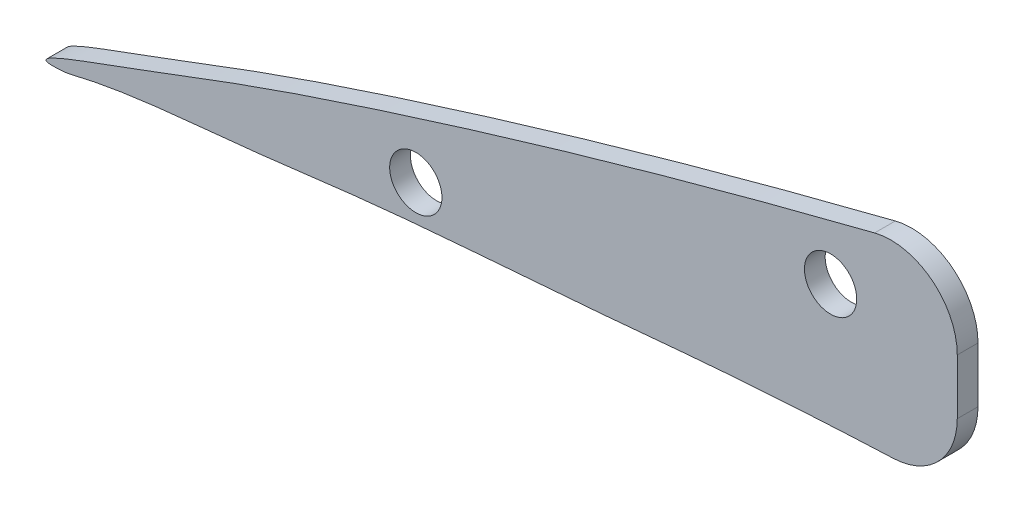
from build123d import *

# Parameters (mm, degrees)
BOSS_EXTRUDE1_DEPTH       = 226.06
CUT_EXTRUDE1_DEPTH        = 248.603669875
CUT_EXTRUDE1_DEPTH_BACK   = 248.603669875
FILLET1_R                 = 5.08
SHELL1_START              = 31.75
SHELL1_DEPTH              = 162.56
SHELL1_START_2            = 3.175
SHELL1_2_DEPTH            = 219.71
SKETCH3_R                 = 2.032
CUT_EXTRUDE2_DEPTH        = 246.233624371
BOSS_EXTRUDE2_START       = -4.025198094
BOSS_EXTRUDE2_OUTLINE_R   = 1.5875
BOSS_EXTRUDE2_DEPTH       = 5.811624811
BOSS_EXTRUDE2_START_2     = -8.955775483
BOSS_EXTRUDE2_2_OUTLINE_R = 1.5875
BOSS_EXTRUDE2_2_DEPTH     = 4.930577389
CUT_EXTRUDE3_DEPTH        = 246.233624371
CUT_EXTRUDE3_DEPTH_BACK   = 246.233624371
SKETCH5_W                 = 235.931423423
SKETCH5_H                 = 77.627996968
SKETCH6_R                 = 2
CUT_EXTRUDE4_DEPTH        = 74.976362333


# Read off the part's stored shape, not the designer's step: Shell1, Boss-Extrude2
with BuildPart() as part:
    # Sketch1 → Boss-Extrude1 (new body)
    with BuildSketch(Plane.XY):
        with BuildLine():
            Line((99.32639085, 18.404394796), (99.32639085, -2.986448862))
            add(Edge.make_bspline(
                [(5.047603806, -9.653713384), (9.482649657, -8.546128483), (16.988483729, -8.076906091), (30.336595099, -6.254410192), (41.946659702, -5.566037344), (65.865842143, -3.231342143), (83.974811725, -3.089086557), (99.32639085, -2.986448862)],
                knots=[0, 0, 0, 0, 0.144322392, 0.237947652, 0.42712275, 0.512831912, 1, 1, 1, 1], degree=3))
            add(Edge.make_bspline(
                [(5.047603806, -9.653713384), (1.304537033, -10.042523479), (11.503328192, -6.353494655), (19.723627138, -3.092777487), (52.915151131, 7.645918304), (77.889766355, 13.460013374), (99.32639085, 18.404394796)],
                knots=[0, 0, 0, 0, 0.059914523, 0.175786391, 0.369274689, 1, 1, 1, 1], degree=3))
        make_face()
    extrude(amount=BOSS_EXTRUDE1_DEPTH)

    # Sketch2 → Cut-Extrude1 (cut, two sides: drawn at the far end of the back side and taken through both)
    with BuildSketch(Plane(origin=(0, 0, 0), x_dir=(1, 0, 0), z_dir=(0, 1, 0)).offset(-CUT_EXTRUDE1_DEPTH_BACK)):
        Polygon((169.681502528, 0), (169.681502528, -226.06), (73.16439085, -226.06), (73.16439085, -197.485), (93.73839085, -197.485), (93.73839085, -28.575), (73.16439085, -28.575), (73.16439085, 0), align=None)
    extrude(amount=CUT_EXTRUDE1_DEPTH + CUT_EXTRUDE1_DEPTH_BACK, mode=Mode.SUBTRACT)

    # Fillet1
    fillet1_edges = [part.edges().sort_by_distance(p)[0] for p in [
        (73.16439085, -3.388889971, 14.2875),
        (73.16439085, 12.236004014, 14.2875),
        (93.73839085, -3.026654485, 113.03),
        (93.73839085, 17.113551214, 113.03),
        (73.16439085, -3.388889971, 211.7725),
        (73.16439085, 12.236004014, 211.7725),
    ]]
    fillet(fillet1_edges, radius=FILLET1_R)

    # Shell1 outline → Shell1 (cut)
    with BuildSketch(Plane.XY.offset(SHELL1_START)):
        with BuildLine():
            ThreePointArc((90.56339085, 10.716231692), (89.84210345, 12.208829924), (88.224441264, 12.571147528))
            add(Edge.make_bspline(
                [(88.224441264, 12.571147528), (87.199954726, 12.331473265), (86.178161178, 12.091844736), (85.158893539, 11.852170354), (84.141984638, 11.612358579), (83.127267128, 11.372317854), (82.11457348, 11.131956606), (81.103735991, 10.891183246), (80.094586779, 10.649906167), (79.086957782, 10.408033746), (78.080680762, 10.165474344), (77.075587303, 9.922136302), (75.365261077, 9.50615692), (74.659515429, 9.333955274), (73.95421322, 9.161291111), (73.24929575, 8.988132524), (72.544704275, 8.814447596), (71.84038, 8.640204402), (71.136264087, 8.465371009), (70.432297655, 8.289915474), (69.728421779, 8.113805846), (69.024577498, 7.937010164), (68.320705808, 7.759496459), (67.616747671, 7.581232754)],
                knots=[0.118068853, 0.118068853, 0.118068853, 0.118068853, 0.118068853, 0.118068853, 0.118068853, 0.118068853, 0.118068853, 0.118068853, 0.118068853, 0.118068853, 0.118068853, 0.242924315, 0.242924315, 0.242924315, 0.242924315, 0.242924315, 0.242924315, 0.242924315, 0.242924315, 0.242924315, 0.242924315, 0.242924315, 0.330745026, 0.330745026, 0.330745026, 0.330745026, 0.330745026, 0.330745026, 0.330745026, 0.330745026, 0.330745026, 0.330745026, 0.330745026, 0.330745026, 0.330745026], degree=12))
            ThreePointArc((67.616747671, 7.581232754), (69.254468773, 7.237834237), (69.98939085, 5.734523672))
            Line((69.98939085, 5.734523672), (69.98939085, 1.506513014))
            ThreePointArc((69.98939085, 1.506513014), (69.459523341, 0.188167221), (68.164681525, -0.396794214))
            add(Edge.make_bspline(
                [(68.164681525, -0.396794214), (68.694992172, -0.374423154), (69.225275053, -0.352727917), (69.755528584, -0.331695291), (70.285751179, -0.311312074), (70.815941255, -0.291565067), (71.346097229, -0.272441078), (71.876217523, -0.25392692), (72.406300557, -0.236009412), (72.936344753, -0.218675382), (73.466348538, -0.201911658), (73.996310335, -0.18570508), (74.526228574, -0.170042489), (75.056101682, -0.154910735), (76.522372139, -0.114466983), (77.45867021, -0.090254504), (78.394813662, -0.06758666), (79.330793845, -0.046390933), (80.266602102, -0.026594862), (81.202229769, -0.008126042), (82.137668173, 0.009087874), (83.072908636, 0.025119175), (84.007942471, 0.040040096), (84.942760983, 0.053922812), (85.87735547, 0.066839443), (86.811717225, 0.07886205), (87.74583753, 0.09006264), (88.679707661, 0.100513159)],
                knots=[0.67202474, 0.67202474, 0.67202474, 0.67202474, 0.67202474, 0.67202474, 0.67202474, 0.67202474, 0.67202474, 0.67202474, 0.67202474, 0.67202474, 0.67202474, 0.67202474, 0.67202474, 0.75, 0.75, 0.75, 0.75, 0.75, 0.75, 0.75, 0.75, 0.75, 0.75, 0.75, 0.75, 0.75, 0.887817721, 0.887817721, 0.887817721, 0.887817721, 0.887817721, 0.887817721, 0.887817721, 0.887817721, 0.887817721, 0.887817721, 0.887817721, 0.887817721, 0.887817721, 0.887817721, 0.887817721], degree=14))
            ThreePointArc((88.679707661, 0.100513159), (90.012944885, 0.665913267), (90.56339085, 2.0053939))
            Line((90.56339085, 2.0053939), (90.56339085, 10.716231692))
        make_face()
        with BuildLine():
            ThreePointArc((69.98939085, 5.734523672), (69.254468773, 7.237834237), (67.616747644, 7.581232862))
            add(Edge.make_bspline(
                [(67.616747644, 7.581232862), (65.399836461, 7.019843113), (63.182067917, 6.451015332), (60.961598132, 5.873750666), (58.736579605, 5.2870495), (56.505161763, 4.689911333), (54.265491496, 4.081334769), (52.015713682, 3.460317509), (49.753971716, 2.825856339), (47.478408044, 2.176947117), (45.187164685, 1.512584769), (42.878383765, 0.831763272), (40.358491497, 0.075974277), (40.166643435, 0.018354472), (39.974662823, -0.039384328), (39.782548624, -0.097242688), (39.590299803, -0.155221168), (39.397915321, -0.213320331), (39.205394144, -0.271540739), (39.012735233, -0.329882954), (38.819937552, -0.388347539), (38.627000064, -0.446935056), (38.433921733, -0.505646067), (38.047481311, -0.6233162), (37.854115889, -0.68227633), (37.660618706, -0.741357704), (37.46700324, -0.800556496), (37.273282999, -0.859868869), (37.079471514, -0.919290978), (36.885582349, -0.97881897), (36.69162909, -1.038448983), (36.497625354, -1.098177145), (36.303584785, -1.157999576), (36.109521054, -1.217912388), (35.527301471, -1.397910273), (35.139116839, -1.518254909), (34.751002758, -1.638914656), (34.363068079, -1.759858551), (33.975421705, -1.881055606), (33.588172595, -2.002474805), (33.20142976, -2.124085105), (32.815302268, -2.245855438), (32.429899238, -2.367754709), (32.045329846, -2.489751794), (31.66170332, -2.611815547), (31.123971117, -2.783433666), (30.968986334, -2.832958389), (30.814181899, -2.882486873), (30.659565113, -2.93201703), (30.505143284, -2.981546776), (30.350923715, -3.031074022), (30.196913716, -3.080596682), (30.043120596, -3.130112665), (29.889551668, -3.179619883), (29.736214245, -3.229116246), (29.583115647, -3.27859966), (29.430263192, -3.328068033)],
                knots=[0.330745026, 0.330745026, 0.330745026, 0.330745026, 0.330745026, 0.330745026, 0.330745026, 0.330745026, 0.330745026, 0.330745026, 0.330745026, 0.330745026, 0.330745026, 0.607310788, 0.607310788, 0.607310788, 0.607310788, 0.607310788, 0.607310788, 0.607310788, 0.607310788, 0.607310788, 0.607310788, 0.607310788, 0.630084943, 0.630084943, 0.630084943, 0.630084943, 0.630084943, 0.630084943, 0.630084943, 0.630084943, 0.630084943, 0.630084943, 0.630084943, 0.652859097, 0.652859097, 0.652859097, 0.652859097, 0.652859097, 0.652859097, 0.652859097, 0.652859097, 0.652859097, 0.652859097, 0.652859097, 0.698407406, 0.698407406, 0.698407406, 0.698407406, 0.698407406, 0.698407406, 0.698407406, 0.698407406, 0.698407406, 0.698407406, 0.698407406, 0.716880093, 0.716880093, 0.716880093, 0.716880093, 0.716880093, 0.716880093, 0.716880093, 0.716880093, 0.716880093, 0.716880093, 0.716880093, 0.716880093, 0.716880093], degree=12))
            add(Edge.make_bspline(
                [(29.430263192, -3.328068033), (30.192321788, -3.253103705), (30.953742852, -3.181055792), (31.714498333, -3.111652976), (32.474560286, -3.044625223), (33.233901052, -2.979703638), (33.992493217, -2.916620464), (34.750309569, -2.855109092), (35.507323058, -2.794904058), (36.26350675, -2.735741051), (37.018833789, -2.677356913), (37.77327735, -2.619489644), (38.526810601, -2.561878406), (39.27940666, -2.504263523), (40.241275886, -2.430197827), (40.451437795, -2.413988578), (40.661523692, -2.397753121), (40.871532992, -2.381485838), (41.081465111, -2.36518111), (41.291319462, -2.34883332), (41.501095461, -2.332436848), (41.710792523, -2.315986075), (41.920410064, -2.299475384), (42.129947497, -2.282899155), (42.339404239, -2.266251771), (42.548779704, -2.249527611), (42.758073307, -2.232721059), (43.071890042, -2.207379213), (43.176475009, -2.198909942), (43.281039293, -2.190417989), (43.38558282, -2.181902656), (43.490105518, -2.173363251), (43.594607315, -2.164799076), (43.699088138, -2.156209439), (43.803547915, -2.147593642), (43.907986571, -2.138950992), (44.012404037, -2.130280793), (44.116800238, -2.12158235), (44.221175102, -2.112854969), (44.325528557, -2.104097954), (44.482026516, -2.090916937), (44.534185416, -2.08651578), (44.586353102, -2.082106088), (44.638462372, -2.077692142), (44.690677468, -2.073262507), (44.74276457, -2.068834253), (44.79486261, -2.064396055), (44.84709011, -2.05993977), (44.899190406, -2.055485443), (44.951182515, -2.051030032), (45.003429676, -2.046545196), (45.055514905, -2.042065555), (45.107662823, -2.037572174), (45.211955574, -2.028569312), (45.264108442, -2.024059127), (45.316267814, -2.019540326), (45.368433702, -2.015013048), (45.42060612, -2.010477431), (45.472785076, -2.005933613), (45.524970589, -2.001381732), (45.577162664, -1.996821927), (45.629361319, -1.992254336), (45.681566563, -1.987679097), (45.73377841, -1.983096348), (45.785996871, -1.978506228), (45.838221958, -1.973908876), (46.3083075, -1.93246885), (46.726586222, -1.895179261), (47.145296128, -1.857506655), (47.564443519, -1.819522312), (47.98403472, -1.781297798), (48.404076086, -1.742904961), (48.824573993, -1.704415937), (49.24553485, -1.665903148), (49.66696508, -1.627439299), (50.088871145, -1.589097383), (50.511259522, -1.550950675), (50.934136722, -1.513072738), (51.357509275, -1.47553742), (51.834368049, -1.433779033), (51.8873602, -1.429145723), (51.940360205, -1.424519069), (51.993368079, -1.419899217), (52.046383832, -1.415286311), (52.099407479, -1.410680497), (52.152439032, -1.40608192), (52.205478504, -1.401490725), (52.258525908, -1.396907058), (52.311581256, -1.392331062), (52.364644562, -1.387762884), (52.417715838, -1.38320267), (52.470795096, -1.378650563), (52.576969604, -1.369562855), (52.630062039, -1.365027462), (52.683179331, -1.360499209), (52.736263003, -1.355982684), (52.78940087, -1.351471194), (52.842545574, -1.346968801), (52.895651993, -1.342479031), (52.948780943, -1.337996995), (53.001972248, -1.333519945), (53.055147327, -1.329054684), (53.108262643, -1.324604451), (53.161436979, -1.320159017), (53.214588182, -1.31572572), (53.37405314, -1.302454763), (53.48036356, -1.293647424), (53.586674415, -1.284879943), (53.692985692, -1.276152212), (53.799297377, -1.267464124), (53.905609457, -1.258815573), (54.011921919, -1.25020645), (54.118234749, -1.241636649), (54.224547934, -1.233106063), (54.330861461, -1.224614583), (54.437175316, -1.216162103), (54.543489487, -1.207748516), (54.649803959, -1.199373714), (54.96874824, -1.174365343), (55.181378913, -1.157847807), (55.394010633, -1.141484125), (55.606643294, -1.125273441), (55.819276791, -1.109214898), (56.031911017, -1.093307639), (56.244545869, -1.077550807), (56.457181238, -1.061943545), (56.669817021, -1.046484998), (56.882453112, -1.031174307), (57.095089404, -1.016010616), (57.307725793, -1.000993068), (57.520362172, -0.986120806), (58.158270965, -0.941937311), (58.583543022, -0.913059346), (59.008813776, -0.884752245), (59.434082397, -0.857009171), (59.859348051, -0.829823289), (60.284609909, -0.803187765), (60.709867137, -0.777095761), (61.135118907, -0.751540443), (61.560364383, -0.726514975), (61.985602738, -0.702012521), (62.410833137, -0.678026246), (62.83605475, -0.654549315), (63.261266746, -0.631574892), (64.006388166, -0.592183223), (64.32630213, -0.575550919), (64.646209835, -0.559196323), (64.96611093, -0.543116532), (65.286005067, -0.527308639), (65.605891895, -0.511769741), (65.925771064, -0.496496937), (66.245642227, -0.481487322), (66.565505034, -0.466737997), (66.885359135, -0.45224606), (67.205204184, -0.438008612), (67.52503983, -0.424022754), (67.844865727, -0.410285587), (68.164681525, -0.396794215)],
                knots=[0.263276283, 0.263276283, 0.263276283, 0.263276283, 0.263276283, 0.263276283, 0.263276283, 0.263276283, 0.263276283, 0.263276283, 0.263276283, 0.263276283, 0.263276283, 0.263276283, 0.263276283, 0.375, 0.375, 0.375, 0.375, 0.375, 0.375, 0.375, 0.375, 0.375, 0.375, 0.375, 0.375, 0.375, 0.40625, 0.40625, 0.40625, 0.40625, 0.40625, 0.40625, 0.40625, 0.40625, 0.40625, 0.40625, 0.40625, 0.40625, 0.40625, 0.421875, 0.421875, 0.421875, 0.421875, 0.421875, 0.421875, 0.421875, 0.421875, 0.421875, 0.421875, 0.421875, 0.421875, 0.421875, 0.4296875, 0.4296875, 0.4296875, 0.4296875, 0.4296875, 0.4296875, 0.4296875, 0.4296875, 0.4296875, 0.4296875, 0.4296875, 0.4296875, 0.4296875, 0.4375, 0.4375, 0.4375, 0.4375, 0.4375, 0.4375, 0.4375, 0.4375, 0.4375, 0.4375, 0.4375, 0.4375, 0.4375, 0.5, 0.5, 0.5, 0.5, 0.5, 0.5, 0.5, 0.5, 0.5, 0.5, 0.5, 0.5, 0.5, 0.5078125, 0.5078125, 0.5078125, 0.5078125, 0.5078125, 0.5078125, 0.5078125, 0.5078125, 0.5078125, 0.5078125, 0.5078125, 0.5078125, 0.5078125, 0.515625, 0.515625, 0.515625, 0.515625, 0.515625, 0.515625, 0.515625, 0.515625, 0.515625, 0.515625, 0.515625, 0.515625, 0.515625, 0.53125, 0.53125, 0.53125, 0.53125, 0.53125, 0.53125, 0.53125, 0.53125, 0.53125, 0.53125, 0.53125, 0.53125, 0.53125, 0.5625, 0.5625, 0.5625, 0.5625, 0.5625, 0.5625, 0.5625, 0.5625, 0.5625, 0.5625, 0.5625, 0.5625, 0.5625, 0.625, 0.625, 0.625, 0.625, 0.625, 0.625, 0.625, 0.625, 0.625, 0.625, 0.625, 0.625, 0.625, 0.67202474, 0.67202474, 0.67202474, 0.67202474, 0.67202474, 0.67202474, 0.67202474, 0.67202474, 0.67202474, 0.67202474, 0.67202474, 0.67202474, 0.67202474, 0.67202474, 0.67202474], degree=14))
            ThreePointArc((68.164681525, -0.396794215), (69.459523341, 0.188167221), (69.98939085, 1.506513014))
            Line((69.98939085, 1.506513014), (69.98939085, 5.734523672))
        make_face()
    extrude(amount=SHELL1_DEPTH, mode=Mode.SUBTRACT)

    # Shell1 2 outline → Shell1 2 (cut)
    with BuildSketch(Plane.XY.offset(SHELL1_START_2)):
        with BuildLine():
            ThreePointArc((69.98939085, 5.734523672), (69.254468773, 7.237834237), (67.616747644, 7.581232862))
            add(Edge.make_bspline(
                [(67.616747644, 7.581232862), (65.399836461, 7.019843113), (63.182067917, 6.451015332), (60.961598132, 5.873750666), (58.736579605, 5.2870495), (56.505161763, 4.689911333), (54.265491496, 4.081334769), (52.015713682, 3.460317509), (49.753971716, 2.825856339), (47.478408044, 2.176947117), (45.187164685, 1.512584769), (42.878383765, 0.831763272), (40.358491497, 0.075974277), (40.166643435, 0.018354472), (39.974662823, -0.039384328), (39.782548624, -0.097242688), (39.590299803, -0.155221168), (39.397915321, -0.213320331), (39.205394144, -0.271540739), (39.012735233, -0.329882954), (38.819937552, -0.388347539), (38.627000064, -0.446935056), (38.433921733, -0.505646067), (38.047481311, -0.6233162), (37.854115889, -0.68227633), (37.660618706, -0.741357704), (37.46700324, -0.800556496), (37.273282999, -0.859868869), (37.079471514, -0.919290978), (36.885582349, -0.97881897), (36.69162909, -1.038448983), (36.497625354, -1.098177145), (36.303584785, -1.157999576), (36.109521054, -1.217912388), (35.527301471, -1.397910273), (35.139116839, -1.518254909), (34.751002758, -1.638914656), (34.363068079, -1.759858551), (33.975421705, -1.881055606), (33.588172595, -2.002474805), (33.20142976, -2.124085105), (32.815302268, -2.245855438), (32.429899238, -2.367754709), (32.045329846, -2.489751794), (31.66170332, -2.611815547), (31.123971117, -2.783433666), (30.968986334, -2.832958389), (30.814181899, -2.882486873), (30.659565113, -2.93201703), (30.505143284, -2.981546776), (30.350923715, -3.031074022), (30.196913716, -3.080596682), (30.043120596, -3.130112665), (29.889551668, -3.179619883), (29.736214245, -3.229116246), (29.583115647, -3.27859966), (29.430263192, -3.328068033)],
                knots=[0.330745026, 0.330745026, 0.330745026, 0.330745026, 0.330745026, 0.330745026, 0.330745026, 0.330745026, 0.330745026, 0.330745026, 0.330745026, 0.330745026, 0.330745026, 0.607310788, 0.607310788, 0.607310788, 0.607310788, 0.607310788, 0.607310788, 0.607310788, 0.607310788, 0.607310788, 0.607310788, 0.607310788, 0.630084943, 0.630084943, 0.630084943, 0.630084943, 0.630084943, 0.630084943, 0.630084943, 0.630084943, 0.630084943, 0.630084943, 0.630084943, 0.652859097, 0.652859097, 0.652859097, 0.652859097, 0.652859097, 0.652859097, 0.652859097, 0.652859097, 0.652859097, 0.652859097, 0.652859097, 0.698407406, 0.698407406, 0.698407406, 0.698407406, 0.698407406, 0.698407406, 0.698407406, 0.698407406, 0.698407406, 0.698407406, 0.698407406, 0.716880093, 0.716880093, 0.716880093, 0.716880093, 0.716880093, 0.716880093, 0.716880093, 0.716880093, 0.716880093, 0.716880093, 0.716880093, 0.716880093, 0.716880093], degree=12))
            add(Edge.make_bspline(
                [(29.430263192, -3.328068033), (30.192321788, -3.253103705), (30.953742852, -3.181055792), (31.714498333, -3.111652976), (32.474560286, -3.044625223), (33.233901052, -2.979703638), (33.992493217, -2.916620464), (34.750309569, -2.855109092), (35.507323058, -2.794904058), (36.26350675, -2.735741051), (37.018833789, -2.677356913), (37.77327735, -2.619489644), (38.526810601, -2.561878406), (39.27940666, -2.504263523), (40.241275886, -2.430197827), (40.451437795, -2.413988578), (40.661523692, -2.397753121), (40.871532992, -2.381485838), (41.081465111, -2.36518111), (41.291319462, -2.34883332), (41.501095461, -2.332436848), (41.710792523, -2.315986075), (41.920410064, -2.299475384), (42.129947497, -2.282899155), (42.339404239, -2.266251771), (42.548779704, -2.249527611), (42.758073307, -2.232721059), (43.071890042, -2.207379213), (43.176475009, -2.198909942), (43.281039293, -2.190417989), (43.38558282, -2.181902656), (43.490105518, -2.173363251), (43.594607315, -2.164799076), (43.699088138, -2.156209439), (43.803547915, -2.147593642), (43.907986571, -2.138950992), (44.012404037, -2.130280793), (44.116800238, -2.12158235), (44.221175102, -2.112854969), (44.325528557, -2.104097954), (44.482026516, -2.090916937), (44.534185416, -2.08651578), (44.586353102, -2.082106088), (44.638462372, -2.077692142), (44.690677468, -2.073262507), (44.74276457, -2.068834253), (44.79486261, -2.064396055), (44.84709011, -2.05993977), (44.899190406, -2.055485443), (44.951182515, -2.051030032), (45.003429676, -2.046545196), (45.055514905, -2.042065555), (45.107662823, -2.037572174), (45.211955574, -2.028569312), (45.264108442, -2.024059127), (45.316267814, -2.019540326), (45.368433702, -2.015013048), (45.42060612, -2.010477431), (45.472785076, -2.005933613), (45.524970589, -2.001381732), (45.577162664, -1.996821927), (45.629361319, -1.992254336), (45.681566563, -1.987679097), (45.73377841, -1.983096348), (45.785996871, -1.978506228), (45.838221958, -1.973908876), (46.3083075, -1.93246885), (46.726586222, -1.895179261), (47.145296128, -1.857506655), (47.564443519, -1.819522312), (47.98403472, -1.781297798), (48.404076086, -1.742904961), (48.824573993, -1.704415937), (49.24553485, -1.665903148), (49.66696508, -1.627439299), (50.088871145, -1.589097383), (50.511259522, -1.550950675), (50.934136722, -1.513072738), (51.357509275, -1.47553742), (51.834368049, -1.433779033), (51.8873602, -1.429145723), (51.940360205, -1.424519069), (51.993368079, -1.419899217), (52.046383832, -1.415286311), (52.099407479, -1.410680497), (52.152439032, -1.40608192), (52.205478504, -1.401490725), (52.258525908, -1.396907058), (52.311581256, -1.392331062), (52.364644562, -1.387762884), (52.417715838, -1.38320267), (52.470795096, -1.378650563), (52.576969604, -1.369562855), (52.630062039, -1.365027462), (52.683179331, -1.360499209), (52.736263003, -1.355982684), (52.78940087, -1.351471194), (52.842545574, -1.346968801), (52.895651993, -1.342479031), (52.948780943, -1.337996995), (53.001972248, -1.333519945), (53.055147327, -1.329054684), (53.108262643, -1.324604451), (53.161436979, -1.320159017), (53.214588182, -1.31572572), (53.37405314, -1.302454763), (53.48036356, -1.293647424), (53.586674415, -1.284879943), (53.692985692, -1.276152212), (53.799297377, -1.267464124), (53.905609457, -1.258815573), (54.011921919, -1.25020645), (54.118234749, -1.241636649), (54.224547934, -1.233106063), (54.330861461, -1.224614583), (54.437175316, -1.216162103), (54.543489487, -1.207748516), (54.649803959, -1.199373714), (54.96874824, -1.174365343), (55.181378913, -1.157847807), (55.394010633, -1.141484125), (55.606643294, -1.125273441), (55.819276791, -1.109214898), (56.031911017, -1.093307639), (56.244545869, -1.077550807), (56.457181238, -1.061943545), (56.669817021, -1.046484998), (56.882453112, -1.031174307), (57.095089404, -1.016010616), (57.307725793, -1.000993068), (57.520362172, -0.986120806), (58.158270965, -0.941937311), (58.583543022, -0.913059346), (59.008813776, -0.884752245), (59.434082397, -0.857009171), (59.859348051, -0.829823289), (60.284609909, -0.803187765), (60.709867137, -0.777095761), (61.135118907, -0.751540443), (61.560364383, -0.726514975), (61.985602738, -0.702012521), (62.410833137, -0.678026246), (62.83605475, -0.654549315), (63.261266746, -0.631574892), (64.006388166, -0.592183223), (64.32630213, -0.575550919), (64.646209835, -0.559196323), (64.96611093, -0.543116532), (65.286005067, -0.527308639), (65.605891895, -0.511769741), (65.925771064, -0.496496937), (66.245642227, -0.481487322), (66.565505034, -0.466737997), (66.885359135, -0.45224606), (67.205204184, -0.438008612), (67.52503983, -0.424022754), (67.844865727, -0.410285587), (68.164681525, -0.396794215)],
                knots=[0.263276283, 0.263276283, 0.263276283, 0.263276283, 0.263276283, 0.263276283, 0.263276283, 0.263276283, 0.263276283, 0.263276283, 0.263276283, 0.263276283, 0.263276283, 0.263276283, 0.263276283, 0.375, 0.375, 0.375, 0.375, 0.375, 0.375, 0.375, 0.375, 0.375, 0.375, 0.375, 0.375, 0.375, 0.40625, 0.40625, 0.40625, 0.40625, 0.40625, 0.40625, 0.40625, 0.40625, 0.40625, 0.40625, 0.40625, 0.40625, 0.40625, 0.421875, 0.421875, 0.421875, 0.421875, 0.421875, 0.421875, 0.421875, 0.421875, 0.421875, 0.421875, 0.421875, 0.421875, 0.421875, 0.4296875, 0.4296875, 0.4296875, 0.4296875, 0.4296875, 0.4296875, 0.4296875, 0.4296875, 0.4296875, 0.4296875, 0.4296875, 0.4296875, 0.4296875, 0.4375, 0.4375, 0.4375, 0.4375, 0.4375, 0.4375, 0.4375, 0.4375, 0.4375, 0.4375, 0.4375, 0.4375, 0.4375, 0.5, 0.5, 0.5, 0.5, 0.5, 0.5, 0.5, 0.5, 0.5, 0.5, 0.5, 0.5, 0.5, 0.5078125, 0.5078125, 0.5078125, 0.5078125, 0.5078125, 0.5078125, 0.5078125, 0.5078125, 0.5078125, 0.5078125, 0.5078125, 0.5078125, 0.5078125, 0.515625, 0.515625, 0.515625, 0.515625, 0.515625, 0.515625, 0.515625, 0.515625, 0.515625, 0.515625, 0.515625, 0.515625, 0.515625, 0.53125, 0.53125, 0.53125, 0.53125, 0.53125, 0.53125, 0.53125, 0.53125, 0.53125, 0.53125, 0.53125, 0.53125, 0.53125, 0.5625, 0.5625, 0.5625, 0.5625, 0.5625, 0.5625, 0.5625, 0.5625, 0.5625, 0.5625, 0.5625, 0.5625, 0.5625, 0.625, 0.625, 0.625, 0.625, 0.625, 0.625, 0.625, 0.625, 0.625, 0.625, 0.625, 0.625, 0.625, 0.67202474, 0.67202474, 0.67202474, 0.67202474, 0.67202474, 0.67202474, 0.67202474, 0.67202474, 0.67202474, 0.67202474, 0.67202474, 0.67202474, 0.67202474, 0.67202474, 0.67202474], degree=14))
            ThreePointArc((68.164681525, -0.396794215), (69.459523341, 0.188167221), (69.98939085, 1.506513014))
            Line((69.98939085, 1.506513014), (69.98939085, 5.734523672))
        make_face()
    extrude(amount=SHELL1_2_DEPTH, mode=Mode.SUBTRACT)

    # Sketch3 → Cut-Extrude2 (cut, through all)
    with BuildSketch(Plane.XY):
        with Locations((84.713563037, 5.874854857)):
            Circle(SKETCH3_R)
    extrude(amount=CUT_EXTRUDE2_DEPTH, mode=Mode.SUBTRACT)

    # Boss-Extrude2 outline → Boss-Extrude2 (add)
    with BuildSketch(Plane(origin=(0, 0.100513169, 0), x_dir=(0, 0, 1), z_dir=(0, -1, 0)).offset(BOSS_EXTRUDE2_START)):
        with Locations((50.8, -50.615235316)):
            Circle(BOSS_EXTRUDE2_OUTLINE_R)
        with Locations((126.965977315, -52.892053199)):
            Circle(BOSS_EXTRUDE2_OUTLINE_R)
        with Locations((203.16597731, -52.892933198)):
            Circle(BOSS_EXTRUDE2_OUTLINE_R)
        with Locations((76.2, -69.665235316)):
            Circle(BOSS_EXTRUDE2_OUTLINE_R)
        with Locations((152.365977315, -71.942053199)):
            Circle(BOSS_EXTRUDE2_OUTLINE_R)
    extrude(amount=BOSS_EXTRUDE2_DEPTH)

    # Boss-Extrude2 2 outline → Boss-Extrude2 2 (add)
    with BuildSketch(Plane(origin=(0, 0.100513169, 0), x_dir=(0, 0, 1), z_dir=(0, -1, 0)).offset(BOSS_EXTRUDE2_START_2)):
        with Locations((76.2, -69.665235316)):
            Circle(BOSS_EXTRUDE2_2_OUTLINE_R)
        with Locations((152.365977315, -71.942053199)):
            Circle(BOSS_EXTRUDE2_2_OUTLINE_R)
    extrude(amount=BOSS_EXTRUDE2_2_DEPTH)

    # Sketch5 → Cut-Extrude3 (cut, two sides: drawn at the far end of the back side and taken through both)
    with BuildSketch(Plane(origin=(0, 0, 0), x_dir=(0, 0, -1), z_dir=(1, 0, 0)).offset(-CUT_EXTRUDE3_DEPTH_BACK)):
        with Locations((-119.553211712, 3.427401288)):
            Rectangle(SKETCH5_W, SKETCH5_H)
    extrude(amount=CUT_EXTRUDE3_DEPTH + CUT_EXTRUDE3_DEPTH_BACK, mode=Mode.SUBTRACT)

    # Sketch6 → Cut-Extrude4 (cut, through all)
    with BuildSketch(Plane.XY.offset(1.5875)):
        with Locations((31.717603806, -3.557713384)):
            Circle(SKETCH6_R)
        with Locations((63.467603806, 5.586286616)):
            Circle(SKETCH6_R)
    extrude(amount=-CUT_EXTRUDE4_DEPTH, mode=Mode.SUBTRACT)


solid = part.part
